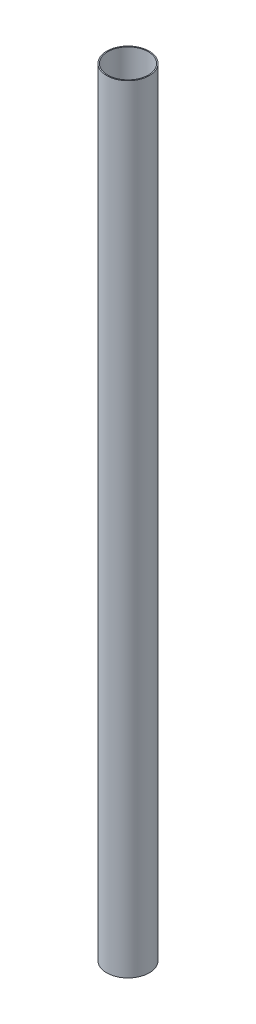
from build123d import *

# Parameters (mm, degrees)
SKETCH1_R   = 25.4
SKETCH1_R_2 = 24.1554
BODY_DEPTH  = 927.1


with BuildPart() as part:
    # Sketch1 → body (new body)
    with BuildSketch(Plane(origin=(0, 0, 0), x_dir=(1, 0, 0), z_dir=(0, 1, 0))):
        Circle(SKETCH1_R)
        Circle(SKETCH1_R_2, mode=Mode.SUBTRACT)
    extrude(amount=BODY_DEPTH)


solid = part.part
